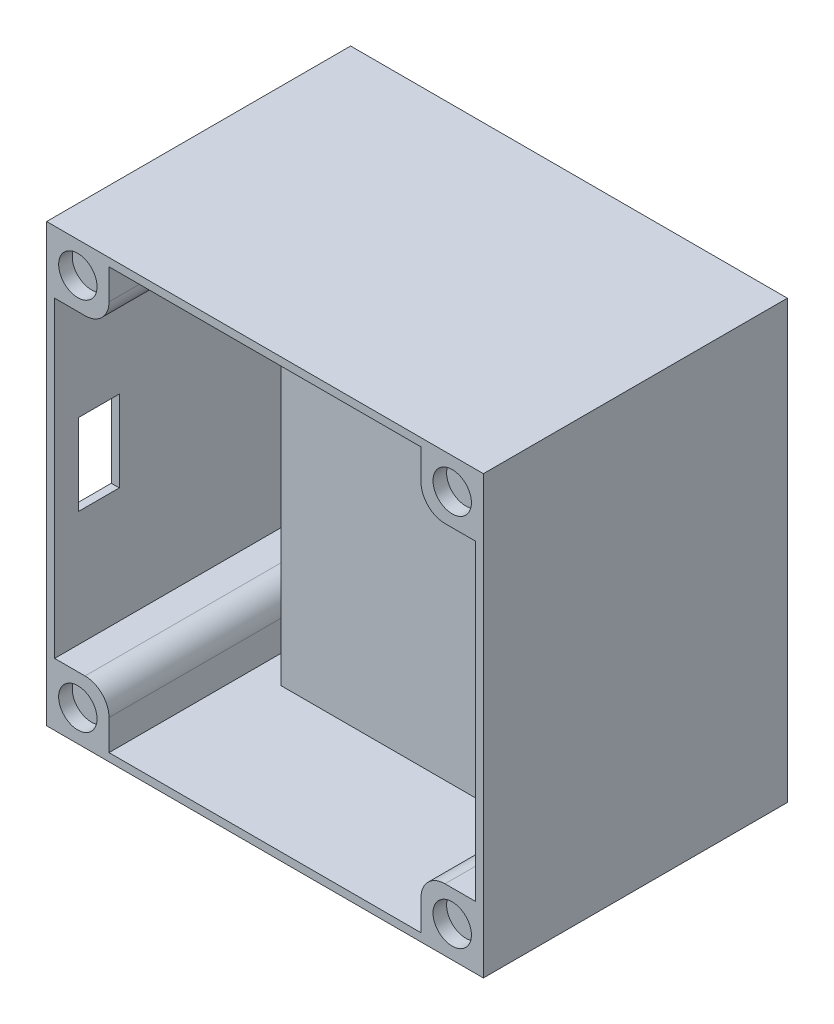
from build123d import *

# Parameters (mm, degrees)
SKICA1_W                  = 54.6
SKICA1_H                  = 54.6
P_IDAT_VYSUNUT_M2_DEPTH   = 3
SKICA14_W                 = 52.6
SKICA14_H                 = 1
P_IDAT_VYSUNUT_M9_DEPTH   = 35
SKICA19_W                 = 7.8
SKICA19_H                 = 7.8
P_IDAT_VYSUNUT_M10_DEPTH  = 38
SKICA20_R                 = 2.4
ODEBRAT_VYSUNUT_M9_DEPTH  = 1.7
ZAOBLIT1_R                = 3
SKICA25_W                 = 32
SKICA25_H                 = 54.6
P_IDAT_VYSUNUT_M12_DEPTH  = 20
SKICA26_W                 = 30
SKICA26_H                 = 52
ODEBRAT_VYSUNUT_M11_DEPTH = 19
SKICA27_W                 = 5.08
SKICA27_H                 = 10.16
ODEBRAT_VYSUNUT_M12_DEPTH = 1
SKICA28_W                 = 9
SKICA28_H                 = 8
ODEBRAT_VYSUNUT_M13_DEPTH = 1
ZAOBLIT3_R                = 4
SKICA29_W                 = 0.5
SKICA29_H                 = 4
ODEBRAT_VYSUNUT_M14_DEPTH = 2
SKICA30_R                 = 0.9
ODEBRAT_VYSUNUT_M15_DEPTH = 2
SKICA31_W                 = 6
SKICA31_H                 = 4
ODEBRAT_VYSUNUT_M16_DEPTH = 2
ZAOBLIT4_R                = 1


with BuildPart() as part:
    # Skica1 → Přidat vysunutím2 (new body)
    with BuildSketch(Plane.XY):
        Rectangle(SKICA1_W, SKICA1_H)
    extrude(amount=P_IDAT_VYSUNUT_M2_DEPTH)

    # Skica14 → Přidat vysunutím9 (add)
    with BuildSketch(Plane.XY.offset(3)):
        Polygon((27.3, 27.3), (-27.3, 27.3), (-27.3, -27.3), (-26.3, -27.3), (-26.3, -26.3), (-26.3, 26.3), (26.3, 26.3), (26.3, -26.3), (26.3, -27.3), (27.3, -27.3), align=None)
        with Locations((0, -26.8)):
            Rectangle(SKICA14_W, SKICA14_H)
    extrude(amount=P_IDAT_VYSUNUT_M9_DEPTH)

    # Skica19 → Přidat vysunutím10 (add)
    with BuildSketch(Plane(origin=(0, 0, 0), x_dir=(-1, 0, 0), z_dir=(0, 0, -1))):
        with Locations((-23.4, 23.4)):
            Rectangle(SKICA19_W, SKICA19_H)
        with Locations((23.4, 23.4)):
            Rectangle(SKICA19_W, SKICA19_H)
        with Locations((-23.4, -23.4)):
            Rectangle(SKICA19_W, SKICA19_H)
        with Locations((23.4, -23.4)):
            Rectangle(SKICA19_W, SKICA19_H)
    extrude(amount=-P_IDAT_VYSUNUT_M10_DEPTH)

    # Skica20 → Odebrat vysunutím9 (cut)
    with BuildSketch(Plane.XY.offset(38)):
        with Locations((-23.4, -23.4)):
            Circle(SKICA20_R)
        with Locations((-23.4, 23.4)):
            Circle(SKICA20_R)
        with Locations((23.400280565, 23.4)):
            Circle(SKICA20_R)
        with Locations((23.400280565, -23.4)):
            Circle(SKICA20_R)
    extrude(amount=-ODEBRAT_VYSUNUT_M9_DEPTH, mode=Mode.SUBTRACT)

    # Zaoblit1
    zaoblit1_edges = [part.edges().sort_by_distance(p)[0] for p in [
        (-19.5, -19.5, 20.5),
        (19.5, 19.5, 20.5),
        (-19.5, 19.5, 20.5),
        (19.5, -19.5, 20.5),
    ]]
    fillet(zaoblit1_edges, radius=ZAOBLIT1_R)

    # Skica25 → Přidat vysunutím12 (add)
    with BuildSketch(Plane(origin=(0, 0, 0), x_dir=(-1, 0, 0), z_dir=(0, 0, -1))):
        Rectangle(SKICA25_W, SKICA25_H)
    extrude(amount=-P_IDAT_VYSUNUT_M12_DEPTH)

    # Skica26 → Odebrat vysunutím11 (cut)
    with BuildSketch(Plane(origin=(0, 0, 0), x_dir=(-1, 0, 0), z_dir=(0, 0, -1))):
        Rectangle(SKICA26_W, SKICA26_H)
    extrude(amount=-ODEBRAT_VYSUNUT_M11_DEPTH, mode=Mode.SUBTRACT)

    # Skica27 → Odebrat vysunutím12 (cut)
    with BuildSketch(Plane.ZY.offset(27.3)):
        with Locations((32.46, 0)):
            Rectangle(SKICA27_W, SKICA27_H)
    extrude(amount=-ODEBRAT_VYSUNUT_M12_DEPTH, mode=Mode.SUBTRACT)

    # Skica28 → Odebrat vysunutím13 (cut)
    with BuildSketch(Plane(origin=(0, 0, 0), x_dir=(-1, 0, 0), z_dir=(0, 0, -1))):
        with Locations((-19.5, 16.940262317)):
            Rectangle(SKICA28_W, SKICA28_H)
    extrude(amount=-ODEBRAT_VYSUNUT_M13_DEPTH, mode=Mode.SUBTRACT)

    # Zaoblit3
    zaoblit3_edges = [part.edges().sort_by_distance(p)[0] for p in [
        (24, 12.940262317, 0.5),
        (24, 20.940262317, 0.5),
    ]]
    fillet(zaoblit3_edges, radius=ZAOBLIT3_R - 0.0001)  # a hair under: the kernel refuses the full size

    # Skica29 → Odebrat vysunutím14 (cut)
    with BuildSketch(Plane(origin=(-15, 0, 0), x_dir=(0, 0, -1), z_dir=(1, 0, 0))):
        with Locations((-0.75, 19)):
            Rectangle(SKICA29_W, SKICA29_H)
        with Locations((-0.83, -19)):
            Rectangle(SKICA29_W, SKICA29_H)
    extrude(amount=-ODEBRAT_VYSUNUT_M14_DEPTH, mode=Mode.SUBTRACT)

    # Skica30 → Odebrat vysunutím15 (cut)
    with BuildSketch(Plane(origin=(0, 0, 1), x_dir=(-1, 0, 0), z_dir=(0, 0, -1))):
        with Locations((-20, 16.940262317)):
            Circle(SKICA30_R)
    extrude(amount=-ODEBRAT_VYSUNUT_M15_DEPTH, mode=Mode.SUBTRACT)

    # Skica31 → Odebrat vysunutím16 (cut)
    with BuildSketch(Plane(origin=(0, 0, 19), x_dir=(-1, 0, 0), z_dir=(0, 0, -1))):
        with Locations((-12, 24)):
            Rectangle(SKICA31_W, SKICA31_H)
    extrude(amount=-ODEBRAT_VYSUNUT_M16_DEPTH, mode=Mode.SUBTRACT)

    # Zaoblit4
    zaoblit4_edges = [part.edges().sort_by_distance(p)[0] for p in [
        (9, 22, 19.5),
    ]]
    fillet(zaoblit4_edges, radius=ZAOBLIT4_R)


solid = part.part
